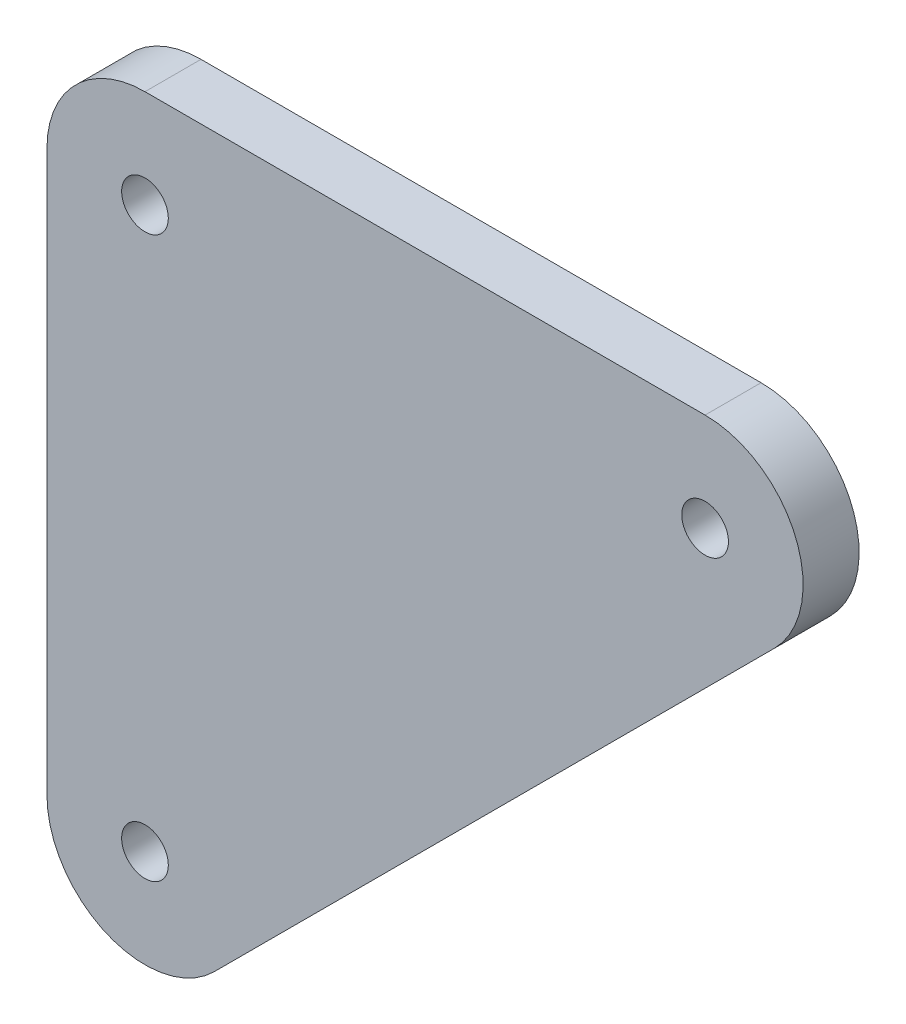
from build123d import *

# Parameters (mm, degrees)
ESBO_O1_R                = 2.5
RESSALTO_EXTRUS_O1_DEPTH = 6


with BuildPart() as part:
    # Esboço1 → Ressalto-extrusão1 (new body)
    with BuildSketch(Plane.XY):
        with BuildLine():
            Line((-22.575378798, -37.424621202), (37.424621202, 22.575378798))
            ThreePointArc((37.424621202, 22.575378798), (39.700735091, 34.01817604), (30, 40.5))
            Line((30, 40.5), (-30, 40.5))
            ThreePointArc((-30, 40.5), (-37.424621202, 37.424621202), (-40.5, 30))
            Line((-40.5, 30), (-40.5, -30))
            ThreePointArc((-40.5, -30), (-34.01817604, -39.700735091), (-22.575378798, -37.424621202))
        make_face()
        with Locations((-30, 30)):
            Circle(ESBO_O1_R, mode=Mode.SUBTRACT)
        with Locations((-30, -30)):
            Circle(ESBO_O1_R, mode=Mode.SUBTRACT)
        with Locations((30, 30)):
            Circle(ESBO_O1_R, mode=Mode.SUBTRACT)
    extrude(amount=RESSALTO_EXTRUS_O1_DEPTH)


solid = part.part
